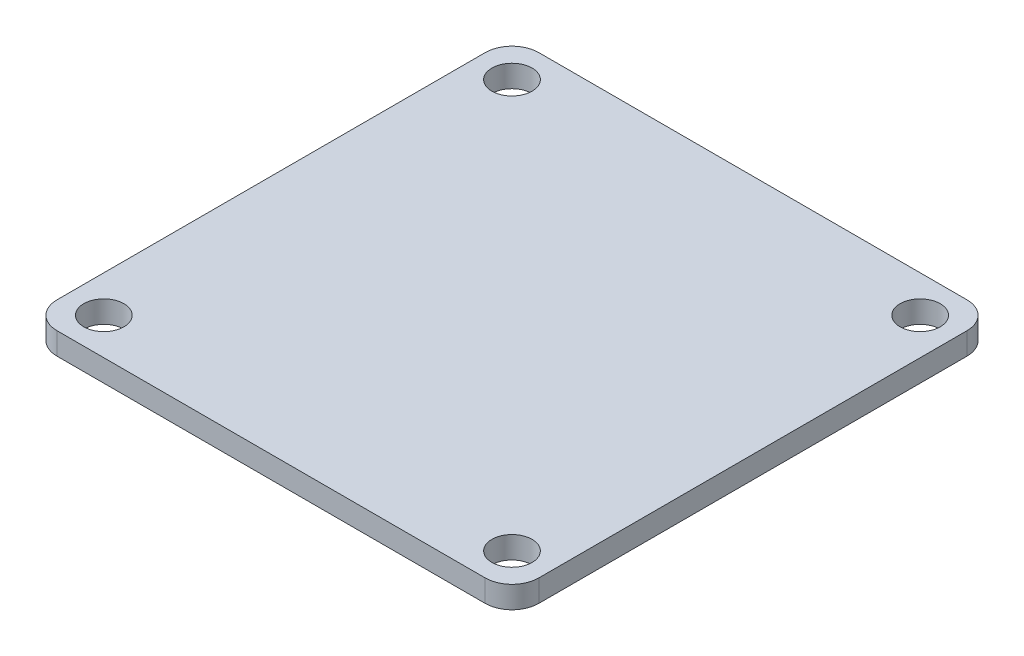
from build123d import *

# Parameters (mm, degrees)
SKETCH1_W         = 36
SKETCH1_H         = 36
SKETCH1_R         = 1.5
BASE_SHAPE_DEPTH  = 1.65
ROUNDED_CORNERS_R = 2


with BuildPart() as part:
    # Sketch1 → Base shape (new body)
    with BuildSketch(Plane(origin=(0, 0, 0), x_dir=(1, 0, 0), z_dir=(0, 1, 0))):
        Rectangle(SKETCH1_W, SKETCH1_H)
        with Locations((-15.25, 15.25)):
            Circle(SKETCH1_R, mode=Mode.SUBTRACT)
        with Locations((15.25, 15.25)):
            Circle(SKETCH1_R, mode=Mode.SUBTRACT)
        with Locations((15.25, -15.25)):
            Circle(SKETCH1_R, mode=Mode.SUBTRACT)
        with Locations((-15.25, -15.25)):
            Circle(SKETCH1_R, mode=Mode.SUBTRACT)
    extrude(amount=BASE_SHAPE_DEPTH)

    # Rounded corners
    rounded_corners_edges = [part.edges().sort_by_distance(p)[0] for p in [
        (-18, 0.825, -18),
        (18, 0.825, -18),
        (18, 0.825, 18),
        (-18, 0.825, 18),
    ]]
    fillet(rounded_corners_edges, radius=ROUNDED_CORNERS_R)


solid = part.part
